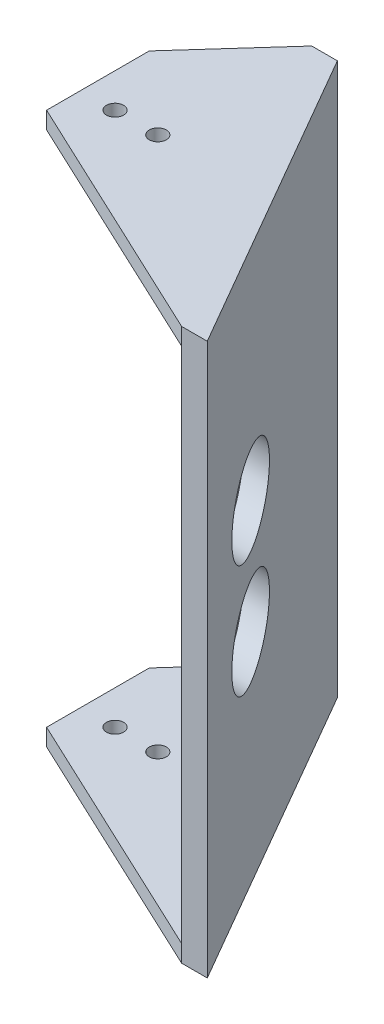
from build123d import *

# Parameters (mm, degrees)
SKETCH1_R               = 1.5875
BOSS_EXTRUDE1_DEPTH     = 3.175
BOSS_EXTRUDE2_DEPTH     = 96.012
BOSS_EXTRUDE3_START     = 3.175
SKETCH3_R               = 1.5875
BOSS_EXTRUDE3_DEPTH     = 3.175
CUT_EXTRUDE1_DEPTH      = 120.133920312
CUT_EXTRUDE1_DEPTH_BACK = 120.133920312
SKETCH5_R               = 8.255
CUT_EXTRUDE2_DEPTH      = 126.74945171


with BuildPart() as part:
    # Sketch1 → Boss-Extrude1 (new body)
    with BuildSketch(Plane(origin=(0, 0, 0), x_dir=(1, 0, 0), z_dir=(0, 1, 0))):
        Polygon((0, 0), (32.995567884, 0), (0, 57.15), (-19.05, 57.15), (-19.05, 0), align=None)
        with Locations((-12.7, 28.575)):
            Circle(SKETCH1_R, mode=Mode.SUBTRACT)
        with Locations((-4.7625, 28.575)):
            Circle(SKETCH1_R, mode=Mode.SUBTRACT)
    extrude(amount=BOSS_EXTRUDE1_DEPTH)

    # Sketch2 → Boss-Extrude2 (add)
    with BuildSketch(Plane.XZ):
        Polygon((0, -57.15), (-4.7625, -57.15), (28.233067884, 0), (32.995567884, 0), align=None)
    extrude(amount=BOSS_EXTRUDE2_DEPTH)

    # Sketch3 → Boss-Extrude3 (add)
    with BuildSketch(Plane.XZ.offset(96.012).offset(BOSS_EXTRUDE3_START)):
        Polygon((32.995567884, 0), (-19.05, 0), (-19.05, -57.15), (0, -57.15), align=None)
        with Locations((-12.7, -28.575)):
            Circle(SKETCH3_R, mode=Mode.SUBTRACT)
        with Locations((-4.7625, -28.575)):
            Circle(SKETCH3_R, mode=Mode.SUBTRACT)
    extrude(amount=-BOSS_EXTRUDE3_DEPTH)

    # Sketch4 → Cut-Extrude1 (cut, two sides: drawn at the far end of the back side and taken through both)
    with BuildSketch(Plane.XZ.offset(-CUT_EXTRUDE1_DEPTH_BACK)):
        Polygon((28.233067884, 0), (-19.05, 0), (-19.05, -22.225), align=None)
        Polygon((-4.7625, -57.15), (-19.05, -41.275), (-19.05, -57.15), align=None)
    extrude(amount=CUT_EXTRUDE1_DEPTH + CUT_EXTRUDE1_DEPTH_BACK, mode=Mode.SUBTRACT)

    # Sketch5 → Cut-Extrude2 (cut, through all)
    with BuildSketch(Plane.ZY.offset(19.05)):
        with Locations((-19.05, -58.547)):
            Circle(SKETCH5_R)
        with Locations((-19.05, -37.465)):
            Circle(SKETCH5_R)
    extrude(amount=-CUT_EXTRUDE2_DEPTH, mode=Mode.SUBTRACT)


solid = part.part
